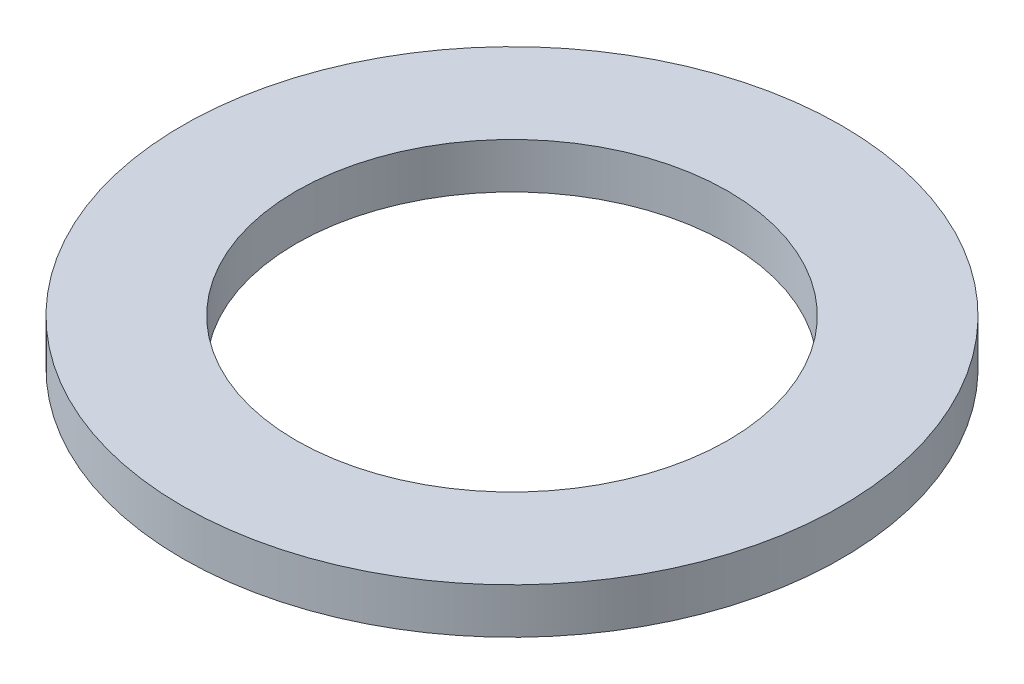
from build123d import *

# Parameters (mm, degrees)
SKETCH1_R           = 72.5
BOSS_EXTRUDE1_DEPTH = 10
SKETCH2_R           = 47.5
CUT_EXTRUDE1_DEPTH  = 104.01698889


with BuildPart() as part:
    # Sketch1 → Boss-Extrude1 (new body)
    with BuildSketch(Plane(origin=(0, 0, 0), x_dir=(1, 0, 0), z_dir=(0, 1, 0))):
        Circle(SKETCH1_R)
    extrude(amount=BOSS_EXTRUDE1_DEPTH)

    # Sketch2 → Cut-Extrude1 (cut, through all)
    with BuildSketch(Plane(origin=(0, 0, 0), x_dir=(1, 0, 0), z_dir=(0, 1, 0))):
        Circle(SKETCH2_R)
    extrude(amount=CUT_EXTRUDE1_DEPTH, mode=Mode.SUBTRACT)


solid = part.part
